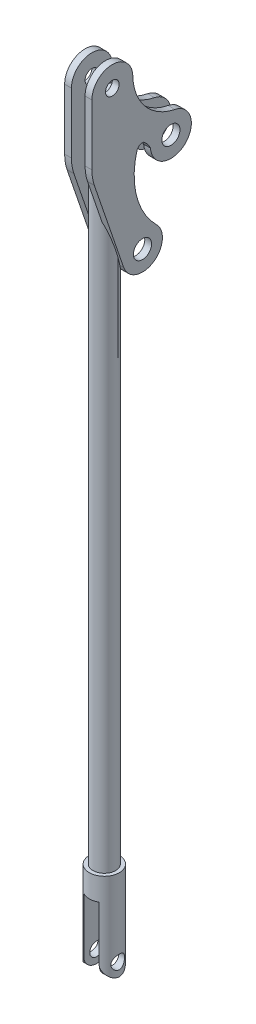
from build123d import *

# Parameters (mm, degrees)
SKETCH_1_R               = 2.5
SKETCH_1_R_2             = 1
EXTRUDE_1_DEPTH          = 160
EXTRUDE_2_DEPTH          = 10
EXTRUDE_2_DEPTH_BACK     = 10
SKETCH_2_R               = 3.3
CUT_EXTRUDE_1_DEPTH      = 15
CUT_EXTRUDE_2_DEPTH      = 161.112116968
CUT_EXTRUDE_2_DEPTH_BACK = 161.112116968
SKETCH_4_R               = 1.5
SKETCH_5_R               = 1.5
SKETCH_5_R_2             = 2.000018691
SKETCH_5_R_3             = 2
EXTRUDE_4_DEPTH          = 1.5
SKETCH_6_R               = 1.5
CUT_EXTRUDE_3_DEPTH      = 166.41323772
CUT_EXTRUDE_4_DEPTH      = 1.5
CUT_EXTRUDE_4_DEPTH_BACK = 1.5
SKETCH_7_R               = 4.501778873


with BuildPart() as part:
    # 草图1 → 凸台-拉伸1 (new body)
    with BuildSketch(Plane(origin=(0, 0, 0), x_dir=(1, 0, 0), z_dir=(0, 1, 0))):
        Circle(SKETCH_1_R)
        Circle(SKETCH_1_R_2, mode=Mode.SUBTRACT)
    extrude(amount=EXTRUDE_1_DEPTH)

    # 草图2 → 凸台-拉伸2 (add, two sides: drawn at the far end of the back side and taken through both)
    with BuildSketch(Plane.XZ.offset(-EXTRUDE_2_DEPTH_BACK)):
        Circle(SKETCH_2_R)
    extrude(amount=EXTRUDE_2_DEPTH + EXTRUDE_2_DEPTH_BACK)

    # 草图3 → 切除-拉伸1 (cut)
    with BuildSketch(Plane.XZ.offset(10)):
        with BuildLine():
            Line((1.7, 2.828427125), (1.7, -2.828427125))
            ThreePointArc((1.7, -2.828427125), (0, -3.3), (-1.7, -2.828427125))
            Line((-1.7, -2.828427125), (-1.7, 2.828427125))
            ThreePointArc((-1.7, 2.828427125), (0, 3.3), (1.7, 2.828427125))
        make_face()
    extrude(amount=-CUT_EXTRUDE_1_DEPTH, mode=Mode.SUBTRACT)

    # 草图4 → 切除-拉伸2 (cut, two sides: drawn at the far end of the back side and taken through both)
    with BuildSketch(Plane.ZY.offset(-1.7).offset(-CUT_EXTRUDE_2_DEPTH_BACK)):
        with Locations((0, -7)):
            Circle(SKETCH_4_R)
        with BuildLine():
            Line((2.828427125, -7), (2.828427125, -10))
            Line((2.828427125, -10), (-2.828427125, -10))
            Line((-2.828427125, -10), (-2.828427125, -7))
            ThreePointArc((-2.828427125, -7), (0, -9.828427125), (2.828427125, -7))
        make_face()
    extrude(amount=CUT_EXTRUDE_2_DEPTH + CUT_EXTRUDE_2_DEPTH_BACK, mode=Mode.SUBTRACT)

    # 草图5 → 凸台-拉伸4 (add)
    with BuildSketch(Plane(origin=(1.5, 0, 0), x_dir=(0, 0, -1), z_dir=(1, 0, 0))):
        with BuildLine():
            Line((-5.736786674, 160), (-5.736786674, 146.672464086))
            ThreePointArc((-5.736786674, 146.672464086), (-5.601167816, 145.031127838), (-5.197989738, 143.43431082))
            Line((-5.197989738, 143.43431082), (1.254559349, 124.581318953))
            ThreePointArc((1.254559349, 124.581318953), (7.706890925, 122.273522143), (8.521742758, 129.07753018))
            ThreePointArc((8.521742758, 129.07753018), (4.121714442, 136.621725938), (4.172735745, 145.355140829))
            ThreePointArc((4.172735745, 145.355140829), (4.76520537, 146.109964773), (5.715938968, 146.239907335))
            ThreePointArc((5.715938968, 146.239907335), (6.536572369, 145.380687625), (7.160459799, 144.369518913))
            ThreePointArc((7.160459799, 144.369518913), (14.612614996, 141.246150359), (12.533616665, 149.054339275))
            ThreePointArc((12.533616665, 149.054339275), (5.958409077, 152.948002092), (3.265672562, 160.099444955))
            ThreePointArc((3.265672562, 160.099444955), (-1.284733312, 164.501504237), (-5.736786674, 160))
        make_face()
        with Locations((-1.2350078, 160)):
            Circle(SKETCH_5_R, mode=Mode.SUBTRACT)
        with Locations((11.654147559, 144.639302795)):
            Circle(SKETCH_5_R_2, mode=Mode.SUBTRACT)
        with Locations((5.401024845, 126.000471538)):
            Circle(SKETCH_5_R_3, mode=Mode.SUBTRACT)
    extrude_4 = extrude(amount=EXTRUDE_4_DEPTH)

    # 镜向1: 凸台-拉伸4 across plane
    add(extrude_4.mirror(Plane(origin=(0, 0, 0), x_dir=(0, 0, 1), z_dir=(1, 0, 0))))

    # 草图6 → 切除-拉伸3 (cut, through all)
    with BuildSketch(Plane(origin=(3, 0, 0), x_dir=(0, 0, -1), z_dir=(1, 0, 0))):
        with Locations((-1.2350078, 160)):
            Circle(SKETCH_6_R)
    extrude(amount=-CUT_EXTRUDE_3_DEPTH, mode=Mode.SUBTRACT)

    # 草图7 → 切除-拉伸4 (cut, two sides: drawn at the far end of the back side and taken through both)
    with BuildSketch(Plane(origin=(0, 0, 0), x_dir=(0, 0, -1), z_dir=(1, 0, 0)).offset(-CUT_EXTRUDE_4_DEPTH_BACK)):
        with Locations((-1.2350078, 160)):
            Circle(SKETCH_7_R)
    extrude(amount=CUT_EXTRUDE_4_DEPTH + CUT_EXTRUDE_4_DEPTH_BACK, mode=Mode.SUBTRACT)


solid = part.part
